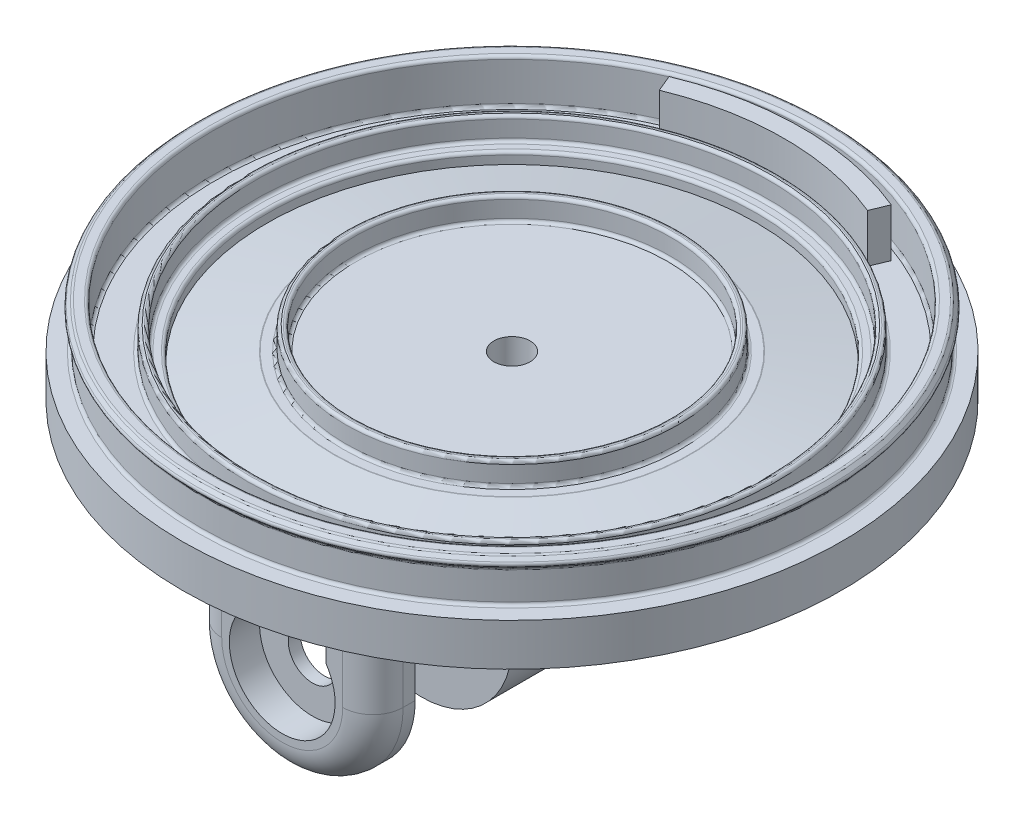
from build123d import *

# Parameters (mm, degrees)
SKETCH2_R                = 54.5
BOSS_EXTRUDE1_DEPTH      = 7
SKETCH4_R                = 43.75
SKETCH4_R_2              = 42.5
SKETCH4_R_3              = 27.5
SKETCH4_R_4              = 26.25
BOSS_EXTRUDE2_DEPTH      = 3.723
FILLET1_R                = 0.5
FILLET2_R                = 0.5
SKETCH6_R                = 3
CUT_EXTRUDE1_DEPTH       = 6
BOSS_EXTRUDE3_DEPTH      = 15
BOSS_EXTRUDE3_DEPTH_BACK = 15
SKETCH7_R                = 4
CUT_EXTRUDE4_DEPTH       = 5
CUT_EXTRUDE4_DEPTH_BACK  = 5
SKETCH10_W               = 38.473117609
SKETCH10_H               = 42.182403499
BOSS_EXTRUDE4_START      = 16
SKETCH11_R               = 4
BOSS_EXTRUDE4_DEPTH      = 2
BOSS_EXTRUDE5_DEPTH      = 5
FILLET3_R                = 5
BOSS_EXTRUDE6_DEPTH      = 8


with BuildPart() as part:
    # Sketch2 → Boss-Extrude1 (new body)
    with BuildSketch(Plane(origin=(0, 0, 0), x_dir=(1, 0, 0), z_dir=(0, 1, 0))):
        Circle(SKETCH2_R)
    extrude(amount=BOSS_EXTRUDE1_DEPTH)

    # Sketch3 → Cut-Revolve1 (revolve, cut)
    with BuildSketch(Plane.XY):
        Polygon((-29.5, 7), (-40.5, 7), (-40.5, 5.127), align=None)
    revolve(axis=Axis((0, 0, 0), (0, 1, 0)), mode=Mode.SUBTRACT)

    # Sketch4 → Boss-Extrude2 (add)
    # profile 1 of 2: a face of its own
    with BuildSketch(Plane(origin=(0, 7, 0), x_dir=(1, 0, 0), z_dir=(0, 1, 0))):
        Circle(SKETCH4_R)
        Circle(SKETCH4_R_2, mode=Mode.SUBTRACT)
    # profile 2 of 2: a face of its own
    with BuildSketch(Plane(origin=(0, 7, 0), x_dir=(1, 0, 0), z_dir=(0, 1, 0))):
        Circle(SKETCH4_R_3)
        Circle(SKETCH4_R_4, mode=Mode.SUBTRACT)
    extrude(amount=BOSS_EXTRUDE2_DEPTH)

    # Fillet1
    fillet1_edges = [part.edges().sort_by_distance(p)[0] for p in [
        (-26.25, 7, 0),
        (29.5, 7, 0),
        (40.5, 7, 0),
        (-43.75, 10.723, 0),
        (-42.5, 7, 0),
        (-42.5, 10.723, 0),
        (-27.5, 7, 0),
        (-27.5, 10.723, 0),
        (-26.25, 10.723, 0),
        (-43.75, 7, 0),
    ]]
    fillet(fillet1_edges, radius=FILLET1_R)

    # Sketch5 → Revolve1 (revolve)
    with BuildSketch(Plane.XY):
        Polygon((-49.5, 7), (-51.5, 7), (-51.5, 12.323), (-52.5, 13.323), (-51.5, 14.323), (-49.5, 14.323), align=None)
    revolve(axis=Axis((0, 7, 0), (0, 1, 0)))

    # Fillet2
    fillet2_edges = [part.edges().sort_by_distance(p)[0] for p in [
        (51.5, 7, 0),
        (49.5, 7, 0),
        (49.5, 14.323, 0),
        (51.5, 14.323, 0),
        (51.5, 12.323, 0),
        (52.5, 13.323, 0),
    ]]
    fillet(fillet2_edges, radius=FILLET2_R)

    # Sketch6 → Cut-Extrude1 (cut)
    with BuildSketch(Plane(origin=(0, 7, 0), x_dir=(1, 0, 0), z_dir=(0, 1, 0))):
        Circle(SKETCH6_R)
    extrude(amount=-CUT_EXTRUDE1_DEPTH, mode=Mode.SUBTRACT)

    # Sketch7 → Boss-Extrude3 (add, two sides: drawn at the far end of the back side and taken through both)
    with BuildSketch(Plane.XY.offset(-BOSS_EXTRUDE3_DEPTH_BACK)):
        with BuildLine():
            Line((15, 0), (-15, 0))
            Line((-15, 0), (-15, -20))
            ThreePointArc((-15, -20), (0, -35), (15, -20))
            Line((15, -20), (15, 0))
        make_face()
        with Locations((0, -20)):
            Circle(SKETCH7_R, mode=Mode.SUBTRACT)
    extrude(amount=BOSS_EXTRUDE3_DEPTH + BOSS_EXTRUDE3_DEPTH_BACK)

    # Sketch10 → Cut-Extrude4 (cut, two sides: drawn at the far end of the back side and taken through both)
    with BuildSketch(Plane.XY.offset(-CUT_EXTRUDE4_DEPTH_BACK)):
        with Locations((1.71649294, -21.09120175)):
            Rectangle(SKETCH10_W, SKETCH10_H)
    extrude(amount=CUT_EXTRUDE4_DEPTH + CUT_EXTRUDE4_DEPTH_BACK, mode=Mode.SUBTRACT)

    # Sketch11 → Boss-Extrude4 (add)
    with BuildSketch(Plane.XY.offset(15).offset(BOSS_EXTRUDE4_START)):
        with BuildLine():
            Line((15, -20), (15, 0))
            Line((15, 0), (-15, 0))
            Line((-15, 0), (-15, -20))
            ThreePointArc((-15, -20), (0, -35), (15, -20))
        make_face()
        with Locations((0, -20)):
            Circle(SKETCH11_R, mode=Mode.SUBTRACT)
    extrude(amount=BOSS_EXTRUDE4_DEPTH)

    # Sketch12 → Boss-Extrude5 (add)
    with BuildSketch(Plane.XY.offset(33)):
        with BuildLine():
            Line((-7.25, -15.101020514), (-7.25, 0))
            Line((-7.25, 0), (-15, 0))
            Line((-15, 0), (-15, -20))
            ThreePointArc((-15, -20), (0, -35), (15, -20))
            Line((15, -20), (15, 0))
            Line((15, 0), (7.25, 0))
            Line((7.25, 0), (7.25, -15.101020514))
            ThreePointArc((7.25, -15.101020514), (8.366600265, -17.438262309), (8.75, -20))
            ThreePointArc((8.75, -20), (-2.561737691, -28.366600265), (-7.25, -15.101020514))
        make_face()
    extrude(amount=BOSS_EXTRUDE5_DEPTH)

    # Fillet3
    fillet3_edges = [part.edges().sort_by_distance(p)[0] for p in [
        (-15, -10, 38),
        (0, -35, 38),
        (15, -10, 38),
    ]]
    fillet(fillet3_edges, radius=FILLET3_R)
    fillet3_2_edges = [part.edges().sort_by_distance(p)[0] for p in [
        (8.625, 0, 38),
    ]]
    fillet(fillet3_2_edges, radius=FILLET3_R)
    fillet3_3_edges = [part.edges().sort_by_distance(p)[0] for p in [
        (-8.625, 0, 38),
    ]]
    fillet(fillet3_3_edges, radius=FILLET3_R)

    # Sketch13 → Boss-Extrude6 (add)
    with BuildSketch(Plane(origin=(0, 7, 0), x_dir=(1, 0, 0), z_dir=(0, 1, 0))):
        with BuildLine():
            Line((18.368804754, 44.346217561), (17.220754456, 41.574578963))
            ThreePointArc((17.220754456, 41.574578963), (0, 45), (-17.220754456, 41.574578963))
            Line((-17.220754456, 41.574578963), (-18.368804754, 44.346217561))
            ThreePointArc((-18.368804754, 44.346217561), (0, 48), (18.368804754, 44.346217561))
        make_face()
    extrude(amount=BOSS_EXTRUDE6_DEPTH)


solid = part.part
